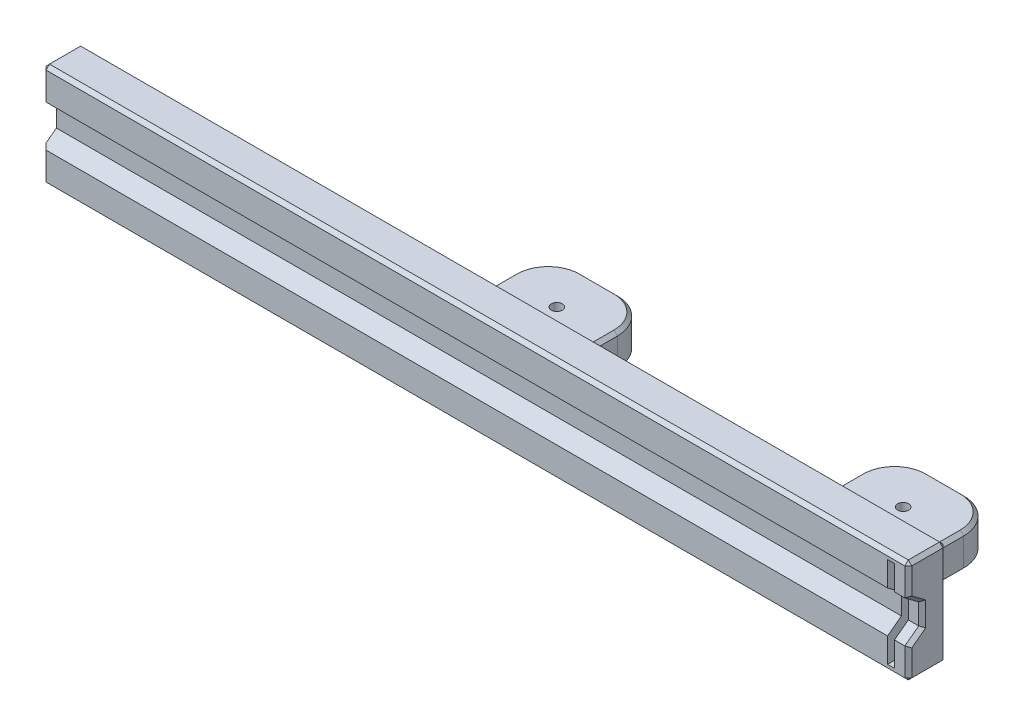
from build123d import *

# Parameters (mm, degrees)
SKETCH_1_W          = 250
SKETCH_1_H          = 30
EXTRUDE_1_DEPTH     = 11
SKETCH_4_W          = 30
SKETCH_4_H          = 10
EXTRUDE_2_DEPTH     = 25
CUT_EXTRUDE_2_DEPTH = 254.031618578
SKETCH_6_R          = 1.6
CUT_EXTRUDE_3_DEPTH = 253.041663223
EXTRUDE_4_DEPTH     = 25
SKETCH_12_R         = 1.6
CUT_EXTRUDE_5_DEPTH = 253.041663223
FILLET_1_R          = 10
SKETCH_13_W         = 2
SKETCH_13_H         = 26.2
CUT_EXTRUDE_6_DEPTH = 255.354083907
CHAMFER_1_SIZE      = 1


with BuildPart() as part:
    # 草圖1 → 填料-伸長1 (new body)
    with BuildSketch(Plane.XY):
        with Locations((125, 15)):
            Rectangle(SKETCH_1_W, SKETCH_1_H)
    extrude(amount=EXTRUDE_1_DEPTH)

    # 草圖4 → 填料-伸長2 (add)
    with BuildSketch(Plane(origin=(0, 0, 0), x_dir=(-1, 0, 0), z_dir=(0, 0, -1))):
        with Locations((-125, 15)):
            Rectangle(SKETCH_4_W, SKETCH_4_H)
    extrude(amount=EXTRUDE_2_DEPTH)

    # 草圖5 → 除料-伸長2 (cut, through all)
    with BuildSketch(Plane(origin=(250, 0, 0), x_dir=(0, 0, -1), z_dir=(1, 0, 0))):
        Polygon((-11, 21), (-11, 9), (-7, 12), (-7, 18), align=None)
    extrude(amount=-CUT_EXTRUDE_2_DEPTH, mode=Mode.SUBTRACT)

    # 草圖6 → 除料-伸長3 (cut, through all)
    with BuildSketch(Plane.XZ.offset(-10)):
        with Locations((125, -12.5)):
            Circle(SKETCH_6_R)
    extrude(amount=-CUT_EXTRUDE_3_DEPTH, mode=Mode.SUBTRACT)

    # 草圖11 → 填料-伸長4 (add)
    with BuildSketch(Plane(origin=(0, 0, 0), x_dir=(-1, 0, 0), z_dir=(0, 0, -1))):
        Polygon((-240, 20), (-240, 10), (-210, 10), (-210, 15), (-210, 20), align=None)
    extrude(amount=EXTRUDE_4_DEPTH)

    # 草圖12 → 除料-伸長5 (cut, through all)
    with BuildSketch(Plane(origin=(0, 20, 0), x_dir=(1, 0, 0), z_dir=(0, 1, 0))):
        with Locations((225, 12.5)):
            Circle(SKETCH_12_R)
    extrude(amount=-CUT_EXTRUDE_5_DEPTH, mode=Mode.SUBTRACT)

    # 圓角1
    fillet_1_edges = [part.edges().sort_by_distance(p)[0] for p in [
        (110, 15, -25),
        (140, 15, -25),
        (210, 15, -25),
        (240, 15, -25),
    ]]
    fillet(fillet_1_edges, radius=FILLET_1_R)

    # 草圖13 → 除料-伸長6 (cut, through all)
    with BuildSketch(Plane.XY.offset(11)):
        with Locations((245, 15)):
            Rectangle(SKETCH_13_W, SKETCH_13_H)
    extrude(amount=-CUT_EXTRUDE_6_DEPTH, mode=Mode.SUBTRACT)

    # 導角1
    chamfer_1_edges = [part.edges().sort_by_distance(p)[0] for p in [
        (250, 15, 0),
        (250, 30, 5.5),
        (250, 0, 5.5),
        (125, 30, 11),
        (125, 0, 11),
        (0, 30, 5.5),
        (125, 30, 0),
        (125, 0, 0),
        (0, 15, 0),
        (0, 0, 5.5),
        (225, 10, -25),
        (225, 20, -25),
        (212.928932188, 20, -22.071067812),
        (212.928932188, 10, -22.071067812),
        (237.071067812, 10, -22.071067812),
        (237.071067812, 20, -22.071067812),
        (225, 20, 0),
        (210, 20, -7.5),
        (210, 15, 0),
        (210, 10, -7.5),
        (225, 10, 0),
        (240, 10, -7.5),
        (240, 15, 0),
        (240, 20, -7.5),
        (125, 20, -25),
        (125, 10, -25),
        (112.928932188, 20, -22.071067812),
        (112.928932188, 10, -22.071067812),
        (137.071067812, 20, -22.071067812),
        (137.071067812, 10, -22.071067812),
        (110, 20, -7.5),
        (125, 10, 0),
        (110, 10, -7.5),
        (110, 15, 0),
        (125, 20, 0),
        (140, 20, -7.5),
        (140, 15, 0),
        (140, 10, -7.5),
        (250, 4.5, 11),
        (250, 10.5, 9),
        (250, 15, 7),
        (250, 19.5, 9),
        (250, 25.5, 11),
        (0, 25.5, 11),
        (0, 4.5, 11),
    ]]
    chamfer(chamfer_1_edges, length=CHAMFER_1_SIZE)


solid = part.part
